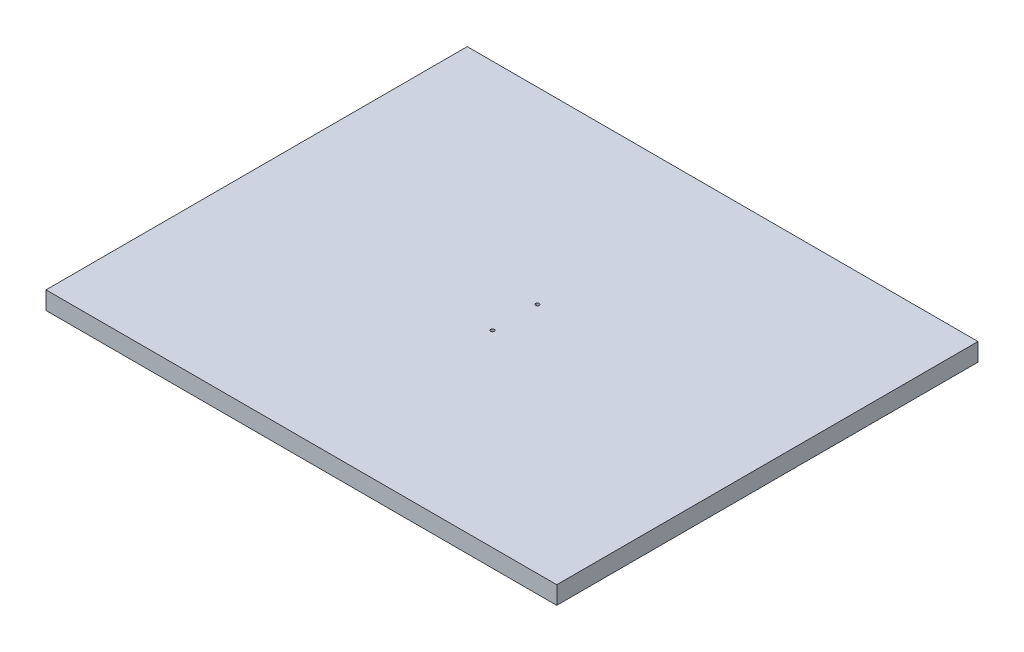
from build123d import *

# Parameters (mm, degrees)
CROQUIS1_W              = 428
CROQUIS1_H              = 353
CROQUIS1_R              = 1.5
SALIENTE_EXTRUIR1_DEPTH = 15


with BuildPart() as part:
    # Croquis1 → Saliente-Extruir1 (new body)
    with BuildSketch(Plane(origin=(0, 0, 0), x_dir=(1, 0, 0), z_dir=(0, 1, 0))):
        Rectangle(CROQUIS1_W, CROQUIS1_H)
        with Locations((2.5, 18.8)):
            Circle(CROQUIS1_R, mode=Mode.SUBTRACT)
        with Locations((2.5, -18.8)):
            Circle(CROQUIS1_R, mode=Mode.SUBTRACT)
    extrude(amount=SALIENTE_EXTRUIR1_DEPTH)


solid = part.part
